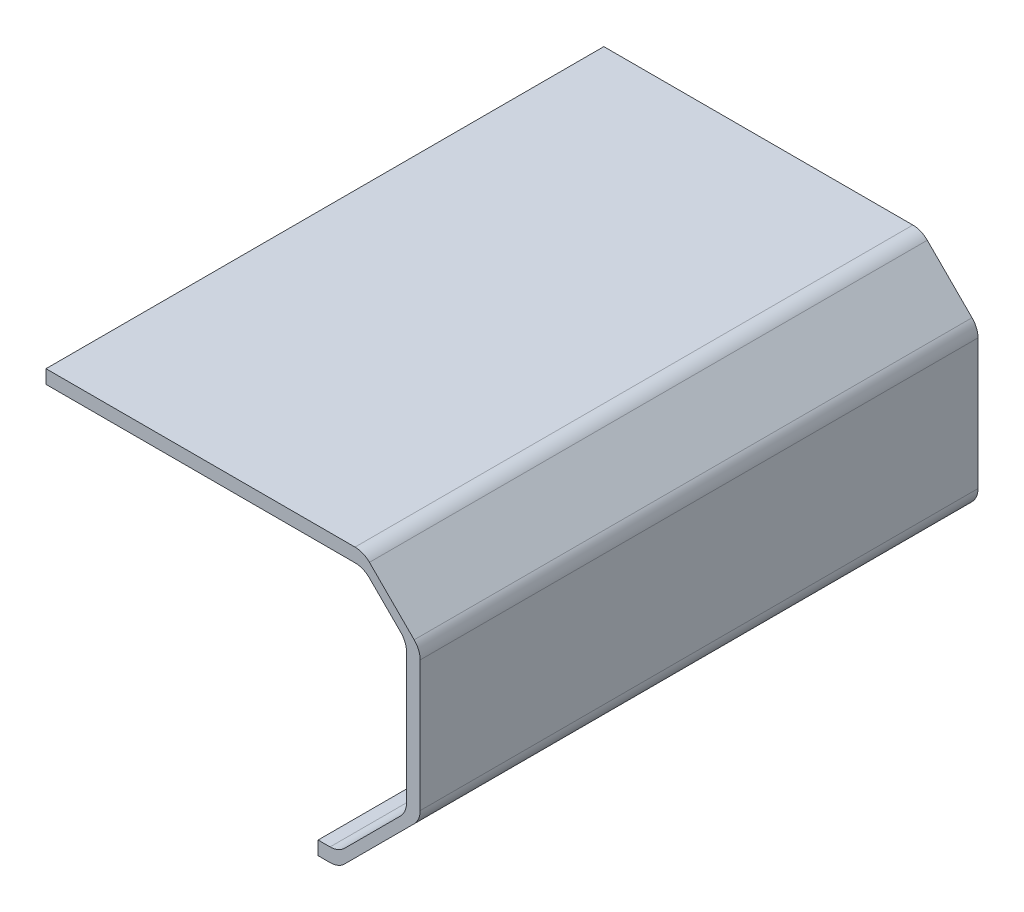
from build123d import *

# Parameters (mm, degrees)
EXTRUDE_1_DEPTH = 82
FILLET_1_R      = 3


with BuildPart() as part:
    # 草图1 → 凸台-拉伸1 (new body)
    with BuildSketch(Plane.XY):
        Polygon((0, 2), (3, 2), (13, 12), (13, 33.666666667), (6.666666667, 40), (-40, 40), (-40, 42), (6.666666667, 42), (15, 33.666666667), (15, 12), (3, 0), (0, 0), align=None)
    extrude(amount=EXTRUDE_1_DEPTH)

    # 圆角1
    fillet_1_edges = [part.edges().sort_by_distance(p)[0] for p in [
        (3, 0, 41),
        (15, 12, 41),
        (3, 2, 41),
        (6.666666667, 42, 41),
        (15, 33.666666667, 41),
        (6.666666667, 40, 41),
        (13, 33.666666667, 41),
        (13, 12, 41),
    ]]
    fillet(fillet_1_edges, radius=FILLET_1_R)


solid = part.part
